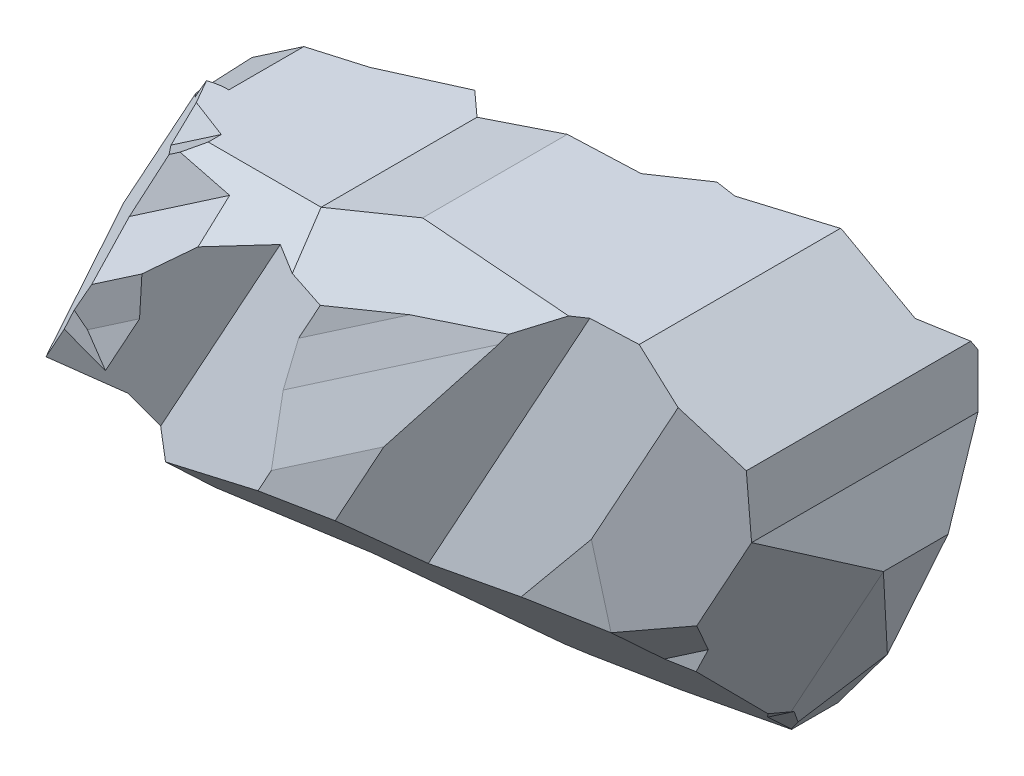
from build123d import *

# Parameters (mm, degrees)
BOSS_EXTRUDE1_DEPTH = 28.956
SKETCH2_OUTSIDE_W   = 104.225
SKETCH2_OUTSIDE_H   = 74.976
CUT_EXTRUDE1_DEPTH  = 28.956
CHAMFER1_SIZE       = 17.78
CHAMFER2_SIZE       = 7.62
CHAMFER3_SIZE       = 7.62
SKETCH3_OUTSIDE_W   = 109.871
SKETCH3_OUTSIDE_H   = 49.7
CUT_EXTRUDE2_DEPTH  = 60.198
SKETCH4_OUTSIDE_W   = 48.856
SKETCH4_OUTSIDE_H   = 100.249
CUT_EXTRUDE3_DEPTH  = 65.532


with BuildPart() as part:
    # Sketch1 → Boss-Extrude1 (new body)
    with BuildSketch(Plane.XY):
        with BuildLine():
            add(Edge.make_bspline(
                [(0, 26.329340351), (-15.786544799, 14.596384946), (-36.267616128, 18.74958365)],
                knots=[0, 0, 0, 1, 1, 1], degree=2))
            add(Edge.make_bspline(
                [(-36.267616128, 18.74958365), (-125.980614733, -26.329340351), (0, -26.329340351)],
                knots=[2.349082937, 2.349082937, 2.349082937, 4.702848639, 4.702848639, 4.702848639], degree=2, weights=[1, 0.374957632, 0.976740293]))
            add(Edge.make_bspline(
                [(0, -26.329340351), (0.906326781, -26.329340351), (1.812095783, -26.313136555)],
                knots=[4.702848639, 4.702848639, 4.702848639, 4.747474319, 4.747474319, 4.747474319], degree=2, weights=[0.976740293, 0.988149653, 1]))
            add(Edge.make_bspline(
                [(0, 26.329340351), (15.016751237, 25.038982394), (44.548809621, 18.28020699), (17.807382706, -25.169253325), (1.812095783, -26.313136555)],
                knots=[0, 0, 0, 0, 0.367872962, 0.976947038, 0.976947038, 0.976947038, 0.976947038], degree=3))
        make_face()
    extrude(amount=BOSS_EXTRUDE1_DEPTH)

    # Sketch2 outside → Cut-Extrude1 (cut)
    with BuildSketch(Plane.XY.offset(28.956)):
        with Locations((-10.7055, 0)):
            Rectangle(SKETCH2_OUTSIDE_W, SKETCH2_OUTSIDE_H)
        Polygon((-45.695007292, 8.912831724), (-42.621617043, 12.754569536), (-31.250073118, 12.754569536), (-23.259258469, 12.754569536), (-13.117070645, 16.903646374), (0, 19.055019548), (12.936005686, 21.176695674), (20.690222102, 16.903646374), (23.432684842, 15.392381036), (23.432684842, 8.912831724), (26.072382633, 2.460237124), (22.061453472, -8.912831724), (15.214644669, -17.471342729), (2.473177364, -21.20584876), (-6.558535322, -22.687169165), (-8.760365364, -22.687169165), (-19.88532873, -16.340644797), (-33.401446293, -16.340644797), (-38.472540205, -8.912831724), (-44.158312167, -6.907636041), (-51.519978603, -1.929165251), align=None, mode=Mode.SUBTRACT)
    extrude(amount=-CUT_EXTRUDE1_DEPTH, mode=Mode.SUBTRACT)

    # Chamfer1
    chamfer1_edges = [part.edges().sort_by_distance(p)[0] for p in [
        (-2.042678979, -21.946508963, 28.956),
    ]]
    chamfer(chamfer1_edges, length=CHAMFER1_SIZE)

    # Chamfer2
    chamfer2_edges = [part.edges().sort_by_distance(p)[0] for p in [
        (-18.188164557, 14.829107955, 28.956),
    ]]
    chamfer(chamfer2_edges, length=CHAMFER2_SIZE)

    # Chamfer3
    chamfer3_edges = [part.edges().sort_by_distance(p)[0] for p in [
        (-22.877919295, 12.754569536, 28.956),
    ]]
    chamfer(chamfer3_edges, length=CHAMFER3_SIZE)

    # Sketch3 outside → Cut-Extrude2 (cut)
    with BuildSketch(Plane(origin=(11.964634426, 21.711980874, 0), x_dir=(0.8758230837475777, -0.4826322885747324, 0), z_dir=(0.4826322885747324, 0.8758230837475777, 0))):
        with Locations((-10.7795, -14.478)):
            Rectangle(SKETCH3_OUTSIDE_W, SKETCH3_OUTSIDE_H)
        Polygon((-41.826185128, -14.74462757), (-38.497860604, -21.336), (-35.00576286, -28.251706873), (-26.526762563, -23.970221502), (-15.967663822, -28.251706873), (-9.823064699, -28.251706873), (-3.406709878, -25.011757782), (6.56253296, -26.631732327), (16.221265926, -25.011757782), (21.647404684, -14.478), (23.623550585, -10.068279635), (16.221265926, -2.384533072), (-1.82963065, -2.384533072), (-12.895364261, -7.972193753), (-26.526762563, -5.757129016), (-32.073003248, 0), (-38.436362681, -6.798953713), (-43.484763158, -6.798953713), (-42.326681299, -7.882839769), align=None, mode=Mode.SUBTRACT)
    extrude(amount=-CUT_EXTRUDE2_DEPTH, mode=Mode.SUBTRACT)

    # Sketch4 outside → Cut-Extrude3 (cut)
    with BuildSketch(Plane(origin=(-30.391792793, -20.748992187, 0), x_dir=(0, 0, 1), z_dir=(-0.8258816978669746, -0.5638434367165795, 0))):
        with Locations((14.126, 6.3845)):
            Rectangle(SKETCH4_OUTSIDE_W, SKETCH4_OUTSIDE_H)
        with BuildLine():
            Line((17.379043474, 33.940305121), (20.033797097, 30.011269758))
            Line((20.033797097, 30.011269758), (22.47617043, 30.011269758))
            Line((22.47617043, 30.011269758), (23.108500778, 26.340870516))
            Line((23.108500778, 26.340870516), (27.148536807, 23.108910338))
            Line((27.148536807, 23.108910338), (26.420684971, 19.743661409))
            Line((26.420684971, 19.743661409), (26.420684971, 15.955142831))
            Line((26.420684971, 15.955142831), (26.992031947, 12.638725208))
            Line((26.992031947, 12.638725208), (28.251706873, 7.392768888))
            Line((28.251706873, 7.392768888), (29.39802431, 2.618893435))
            Line((29.39802431, 2.618893435), (28.824865591, -0.031126348))
            Line((28.824865591, -0.031126348), (26.631732327, -2.772601154))
            Line((26.631732327, -2.772601154), (25.821745055, -9.959999212))
            Line((25.821745055, -9.959999212), (23.108500778, -13.351626593))
            Line((23.108500778, -13.351626593), (22.5757173, -18.07926499))
            Line((22.5757173, -18.07926499), (14.257053213, -21.384760387))
            Line((14.257053213, -21.384760387), (11.527022899, -24.797370761))
            Line((11.527022899, -24.797370761), (2.142356235, -22.767611))
            Line((2.142356235, -22.767611), (4.352503323, -18.07926499))
            Line((4.352503323, -18.07926499), (2.384533072, -14.418186985))
            Line((2.384533072, -14.418186985), (2.384533072, -11.501772175))
            Line((2.384533072, -11.501772175), (2.384533072, -1.401863751))
            Line((2.384533072, -1.401863751), (5.601070504, 2.618893435))
            Line((5.601070504, 2.618893435), (5.601070504, 10.015747048))
            Line((5.601070504, 10.015747048), (6.534511478, 14.331544691))
            Line((6.534511478, 14.331544691), (3.992801788, 18.093275032))
            Line((3.992801788, 18.093275032), (1.999794348, 23.108910338))
            Line((1.999794348, 23.108910338), (5.263656633, 27.188824848))
            Line((5.263656633, 27.188824848), (6.798953713, 29.107986959))
            Line((6.798953713, 29.107986959), (8.293414674, 31.975787439))
            Line((8.293414674, 31.975787439), (15.7861913, 31.975787439))
            ThreePointArc((15.7861913, 31.975787439), (16.234438667, 33.24035335), (17.379043474, 33.940305121))
        make_face(mode=Mode.SUBTRACT)
    extrude(amount=-CUT_EXTRUDE3_DEPTH, mode=Mode.SUBTRACT)


solid = part.part
